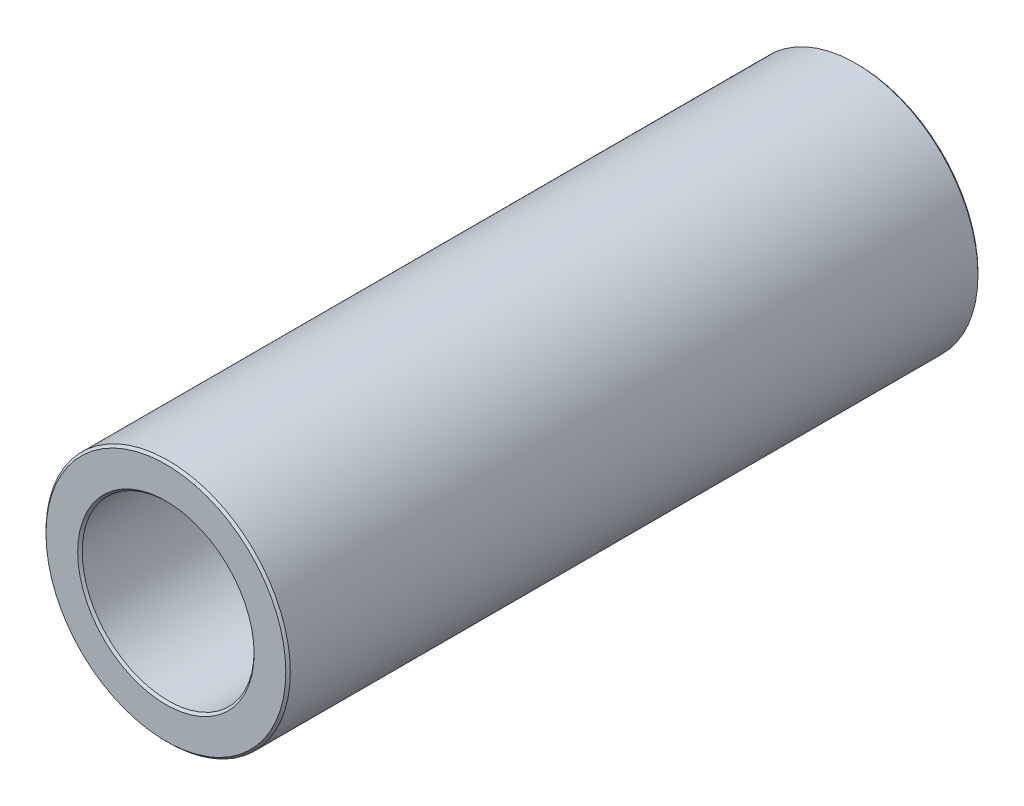
from build123d import *

# Parameters (mm, degrees)
SKIZZE1_R                       = 27
SKIZZE1_R_2                     = 19
AUFSATZ_LINEAR_AUSTRAGEN1_DEPTH = 76.5
FASE1_SIZE                      = 0.5


with BuildPart() as part:
    # Skizze1 → Aufsatz-Linear austragen1 (new, symmetric)
    with BuildSketch(Plane.XY):
        Circle(SKIZZE1_R)
        Circle(SKIZZE1_R_2, mode=Mode.SUBTRACT)
    extrude(amount=AUFSATZ_LINEAR_AUSTRAGEN1_DEPTH, both=True)

    # Fase1
    fase1_edges = [part.edges().sort_by_distance(p)[0] for p in [
        (-27, 0, -76.5),
        (-27, 0, 76.5),
        (-19, 0, -76.5),
        (-19, 0, 76.5),
    ]]
    chamfer(fase1_edges, length=FASE1_SIZE)


solid = part.part
